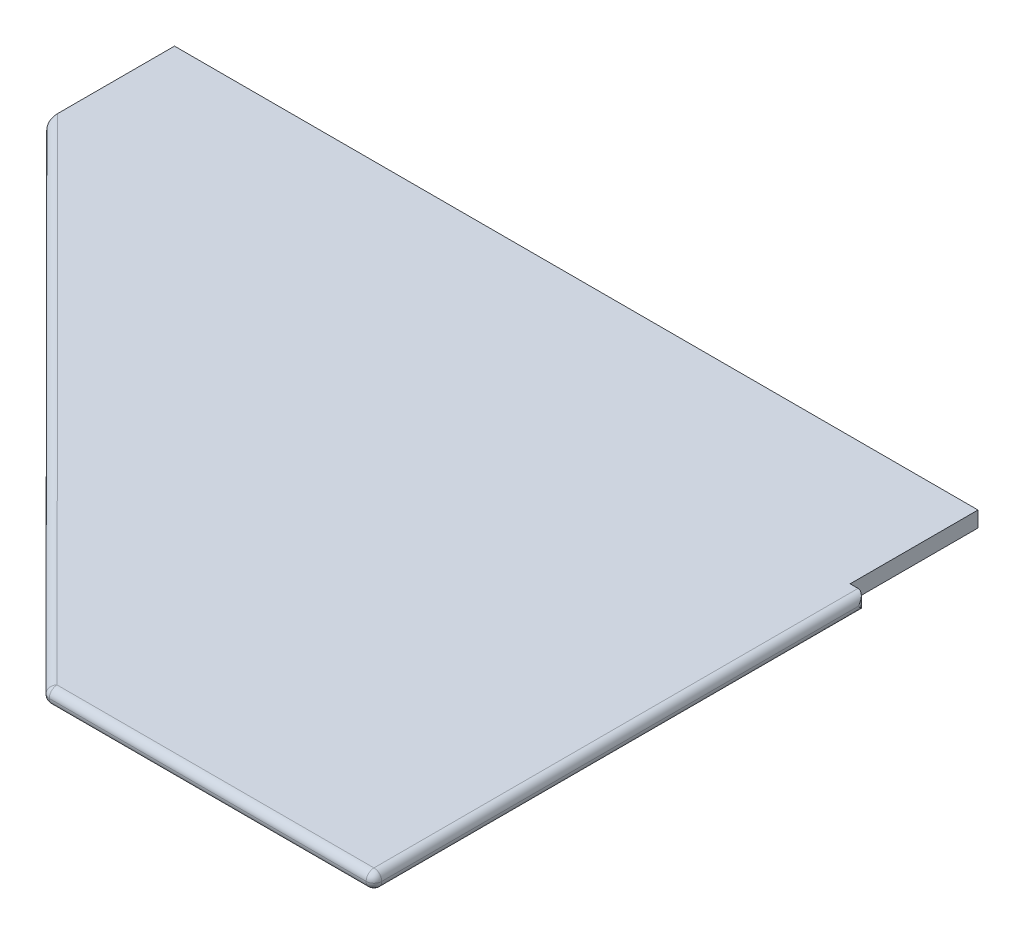
from build123d import *

# Parameters (mm, degrees)
BOSS_EXTRUDE2_DEPTH = 4.76
FILLET11_R          = 2.38


with BuildPart() as part:
    # Sketch1 → Boss-Extrude2 (new body)
    with BuildSketch(Plane(origin=(0, 0, 0), x_dir=(1, 0, 0), z_dir=(0, 1, 0))):
        Polygon((0, 0), (0, 150), (-4.8006, 150), (-4.8006, 188.989), (-249.8006, 188.989), (-249.8006, 150), (-99.9998, 0), align=None)
    extrude(amount=BOSS_EXTRUDE2_DEPTH)

    # Fillet11
    fillet11_edges = [part.edges().sort_by_distance(p)[0] for p in [
        (-49.9999, 0, 0),
        (-99.9998, 2.38, 0),
        (-249.8006, 2.38, -150),
        (0, 2.38, -150),
        (0, 2.38, 0),
        (-174.9002, 4.76, -75),
        (-49.9999, 4.76, 0),
        (-174.9002, 0, -75),
        (0, 4.76, -75),
        (0, 0, -75),
    ]]
    fillet(fillet11_edges, radius=FILLET11_R - 0.0001)  # a hair under: the kernel refuses the full size


solid = part.part
